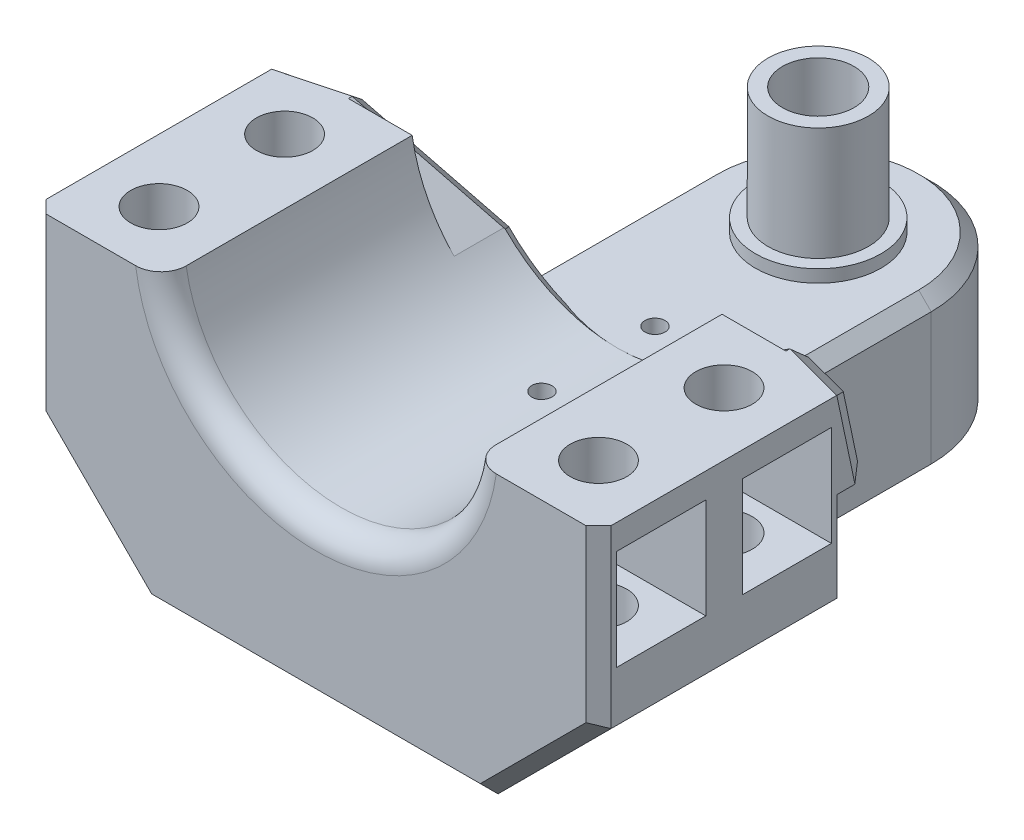
from build123d import *

# Parameters (mm, degrees)
SKETCH1_R               = 2.25
SKETCH1_R_2             = 2.75
BOSS_EXTRUDE1_DEPTH     = 23
CUT_EXTRUDE1_DEPTH      = 10
CUT_EXTRUDE1_DEPTH_BACK = 51.55937104
SKETCH2_R               = 12.5
BOSS_EXTRUDE2_START     = -22.5
BOSS_EXTRUDE2_DEPTH     = 5
CUT_EXTRUDE8_REACH      = 52.496
FILLET1_R               = 2
CHAMFER1_SIZE           = 9
CHAMFER2_SIZE           = 1
SKETCH5_R               = 3.35
CUT_EXTRUDE10_DEPTH     = 4
CUT_EXTRUDE11_START     = -15
SKETCH6_W               = 18
SKETCH6_H               = 3.825324214
CUT_EXTRUDE11_DEPTH     = 36.559371208
CHAMFER3_SIZE           = 1
CHAMFER4_SIZE           = 1
CHAMFER5_SIZE           = 1
CHAMFER6_SIZE           = 1
SKETCH7_R               = 4
SKETCH7_R_2             = 2.85
BOSS_EXTRUDE3_DEPTH     = 10
SKETCH8_R               = 5
SKETCH8_R_2             = 4
EXTRUDE_THIN1_DEPTH     = 1
SKETCH10_R              = 0.3
BOSS_EXTRUDE4_DEPTH     = 4
BOSS_EXTRUDE5_START     = 4
SKETCH11_R              = 2.5
SKETCH11_R_2            = 1.6
BOSS_EXTRUDE5_DEPTH     = 2
SKETCH12_W              = 7.1
SKETCH12_H              = 3
CUT_EXTRUDE12_DEPTH     = 9
CHAMFER7_SIZE           = 5
SKETCH13_R              = 1.6
SKETCH13_R_2            = 0.8
CUT_EXTRUDE13_DEPTH     = 7
BOSS_EXTRUDE6_START     = 2
BOSS_EXTRUDE6_DEPTH     = 2
CUT_EXTRUDE14_REACH     = 52.559
SKETCH13_2_R            = 0.8
CHAMFER8_SIZE           = 1
CHAMFER8_SIZE2          = 1.732050808


with BuildPart() as part:
    # Sketch1 → Boss-Extrude1 (new body)
    with BuildSketch(Plane(origin=(0, 0, 0), x_dir=(1, 0, 0), z_dir=(0, 1, 0))):
        with BuildLine():
            Line((-22.5, -10), (-22.5, 10))
            Line((-22.5, 10), (-9, 10))
            Line((-9, 10), (-9, 30))
            ThreePointArc((-9, 30), (0, 39), (9, 30))
            Line((9, 30), (9, 10))
            Line((9, 10), (22.5, 10))
            Line((22.5, 10), (22.5, -10))
            Line((22.5, -10), (-22.5, -10))
        make_face()
        with Locations(Location((-17.5, 5, 0), (0, 0, 270))):
            Circle(SKETCH1_R, mode=Mode.SUBTRACT)
        with Locations(Location((-17.5, -5, 0), (0, 0, 270))):
            Circle(SKETCH1_R, mode=Mode.SUBTRACT)
        with Locations(Location((17.5, 5, 0), (0, 0, 270))):
            Circle(SKETCH1_R, mode=Mode.SUBTRACT)
        with Locations(Location((17.5, -5, 0), (0, 0, 270))):
            Circle(SKETCH1_R, mode=Mode.SUBTRACT)
        with Locations(Location((0, 30, 0), (0, 0, 270))):
            Circle(SKETCH1_R_2, mode=Mode.SUBTRACT)
    extrude(amount=BOSS_EXTRUDE1_DEPTH)

    # Sketch2 → Cut-Extrude1 (cut, two sides: drawn at the far end of the back side and taken through both)
    with BuildSketch(Plane.XY.offset(-CUT_EXTRUDE1_DEPTH_BACK)):
        with Locations((0, 25)):
            Circle(SKETCH2_R)
    extrude(amount=CUT_EXTRUDE1_DEPTH + CUT_EXTRUDE1_DEPTH_BACK, mode=Mode.SUBTRACT)

    # Sketch3 → Boss-Extrude2 (add)
    with BuildSketch(Plane(origin=(0, 0, -32.5), x_dir=(-1, 0, 0), z_dir=(0, 0, -1)).offset(BOSS_EXTRUDE2_START)):
        Polygon((9, 16.325324214), (17.41948134, 23), (22.5, 23), (22.5, 16.146397564), (9, 5.444060985), align=None)
    boss_extrude2 = extrude(amount=BOSS_EXTRUDE2_DEPTH)

    # Mirror1: Boss-Extrude2 across plane
    add(boss_extrude2.mirror(Plane(origin=(0, 0, 0), x_dir=(0, 0, 1), z_dir=(1, 0, 0))))

    # Sketch4 → Cut-Extrude8 (cut, up to next)
    with BuildSketch(Plane(origin=(4.474031923, 5.643574234, 0), x_dir=(0.7836265295847679, -0.6212322127280048, 0), z_dir=(0.6212322127280048, 0.7836265295847679, 0)), mode=Mode.PRIVATE) as cut_extrude8_sk1:
        Polygon((-17.194456051, 15), (-31.919937808, 10), (-31.919937808, 15.796390808), (-17.194456051, 15.796390808), align=None)
    cut_extrude8_tool1 = extrude(cut_extrude8_sk1.sketch, amount=-CUT_EXTRUDE8_REACH, mode=Mode.PRIVATE) & part.part
    cut_extrude8 = cut_extrude8_tool1.solids().sort_by_distance((-16.228214, 22.055604, -13.832193))[0]
    add(cut_extrude8, mode=Mode.SUBTRACT)

    # Mirror2: Cut-Extrude8 across plane
    add(cut_extrude8.mirror(Plane(origin=(0, 0, 0), x_dir=(0, 0, 1), z_dir=(1, 0, 0))), mode=Mode.SUBTRACT)

    # Fillet1
    fillet1_edges = [part.edges().sort_by_distance(p)[0] for p in [
        (0, 12.5, 10),
    ]]
    fillet(fillet1_edges, radius=FILLET1_R)

    # Chamfer1
    # the kernel refuses this chamfer: 9 mm, written as the material it takes off along each edge
    with BuildSketch(Plane(origin=(22.5, 0, -33.145146892), x_dir=(-0.9996219169112966, -0.027495876610586365, 0), z_dir=(0, 0, 1))) as chamfer1_piece_1:
        Polygon((CHAMFER1_SIZE * 0.999621916911, -CHAMFER1_SIZE * 0.0274958766106), (-CHAMFER1_SIZE * 0.0274958766106, -CHAMFER1_SIZE * 0.999621916911), (0, 0), align=None)
    extrude(amount=66.290293783, mode=Mode.SUBTRACT)
    with BuildSketch(Plane(origin=(-22.5, 0, 33.145146892), x_dir=(-0.02749587661058639, 0.9996219169112966, 0), z_dir=(0, 0, -1))) as chamfer1_piece_2:
        Polygon((CHAMFER1_SIZE * 0.999621916911, CHAMFER1_SIZE * 0.0274958766106), (-CHAMFER1_SIZE * 0.0274958766106, CHAMFER1_SIZE * 0.999621916911), (0, 0), align=None)
    extrude(amount=66.290293783, mode=Mode.SUBTRACT)

    # Chamfer2
    chamfer2_edges = [part.edges().sort_by_distance(p)[0] for p in [
        (-11.25, 0, -10),
        (11.25, 0, -10),
        (18, 4.5, -10),
        (0, 0, 10),
        (-18, 4.5, 10),
        (18, 4.5, 10),
        (-18, 4.5, -10),
        (22.5, 16, 10),
        (-22.5, 16, 10),
        (-22.5, 12.573198782, -10),
        (22.5, 12.573198782, -10),
        (-9, 0, -20),
        (0, 0, -39),
        (9, 0, -20),
    ]]
    chamfer(chamfer2_edges, length=CHAMFER2_SIZE)

    # Sketch5 → Cut-Extrude10 (cut)
    with BuildSketch(Plane(origin=(0, 0, 0), x_dir=(1, 0, 0), z_dir=(0, 1, 0))):
        with Locations(Location((0, 30, 0), (0, 0, 270))):
            Circle(SKETCH5_R)
    extrude(amount=CUT_EXTRUDE10_DEPTH, mode=Mode.SUBTRACT)

    # Sketch6 → Cut-Extrude11 (cut, through all)
    with BuildSketch(Plane.XY.offset(CUT_EXTRUDE11_START)):
        with Locations((0, 14.412662107)):
            Rectangle(SKETCH6_W, SKETCH6_H)
    extrude(amount=-CUT_EXTRUDE11_DEPTH, mode=Mode.SUBTRACT)

    # Chamfer3
    chamfer3_edges = [part.edges().sort_by_distance(p)[0] for p in [
        (0, 12.5, -39),
        (9, 12.5, -22.5),
        (-9, 12.5, -22.5),
    ]]
    chamfer(chamfer3_edges, length=CHAMFER3_SIZE)

    # Chamfer4
    # the kernel refuses this chamfer: 1 mm, written as the material it takes off along each edge
    with BuildSketch(Plane(origin=(0, 25, -15), x_dir=(0, -1, 0), z_dir=(1, 0, 0))) as chamfer4_piece_1_section:
        Polygon((12.5 + CHAMFER4_SIZE, 0), (12.5, -CHAMFER4_SIZE), (12.5, 0), align=None)
    chamfer4_piece_1 = revolve(axis=Axis((0, 25, -15), (0, 0, -1)), revolution_arc=57.843446633, mode=Mode.PRIVATE)
    chamfer4_piece_1 = split(chamfer4_piece_1, bisect_by=Plane(origin=(-3.818564671, 12.5, -14.588370219), z_dir=(0, 1, 0)), keep=Keep.TOP, mode=Mode.PRIVATE)
    add(chamfer4_piece_1, mode=Mode.SUBTRACT)
    with BuildSketch(Plane(origin=(0, 25, -15), x_dir=(0.8465969958559083, -0.5322344658209869, 0), z_dir=(0.5322344658209869, 0.8465969958559083, 0))) as chamfer4_piece_2_section:
        Polygon((12.5, -CHAMFER4_SIZE), (12.5 + CHAMFER4_SIZE, 0), (12.5, 0), align=None)
    chamfer4_piece_2 = revolve(axis=Axis((0, 25, -15), (0, 0, -1)), revolution_arc=57.843446633, mode=Mode.PRIVATE)
    chamfer4_piece_2 = split(chamfer4_piece_2, bisect_by=Plane(origin=(7.537884287, 12.5, -14.673877281), z_dir=(0, 1, 0)), keep=Keep.TOP, mode=Mode.PRIVATE)
    add(chamfer4_piece_2, mode=Mode.SUBTRACT)

    # Chamfer5
    chamfer5_edges = [part.edges().sort_by_distance(p)[0] for p in [
        (-11.648575872, 7.543761018, -15),
        (-18.398575872, 12.894929307, -13.222841989),
        (-13.931019885, 20.234467509, -12.863375935),
        (18.398575872, 12.894929307, -13.222841989),
        (11.648575872, 7.543761018, -15),
        (13.931019885, 20.234467509, -12.863375935),
    ]]
    chamfer(chamfer5_edges, length=CHAMFER5_SIZE)

    # Chamfer6
    chamfer6_edges = [part.edges().sort_by_distance(p)[0] for p in [
        (20.764592688, 23, -10.461754404),
        (-22.5, 20.211257833, -10.588251201),
        (22.5, 20.211257833, -10.588251201),
        (-20.764592688, 23, -10.461754404),
    ]]
    chamfer(chamfer6_edges, length=CHAMFER6_SIZE)

    # Sketch7 → Boss-Extrude3 (add)
    with BuildSketch(Plane(origin=(0, 12.5, 0), x_dir=(1, 0, 0), z_dir=(0, 1, 0))):
        with Locations((0, 30)):
            Circle(SKETCH7_R)
        with Locations(Location((0, 30, 0), (0, 0, 180))):
            Circle(SKETCH7_R_2, mode=Mode.SUBTRACT)
    extrude(amount=BOSS_EXTRUDE3_DEPTH)

    # Sketch8 → Extrude-Thin1 (add)
    with BuildSketch(Plane(origin=(0, 12.5, 0), x_dir=(1, 0, 0), z_dir=(0, 1, 0))):
        with Locations((0, 30)):
            Circle(SKETCH8_R)
        with Locations((0, 30)):
            Circle(SKETCH8_R_2, mode=Mode.SUBTRACT)
    extrude(amount=EXTRUDE_THIN1_DEPTH)

    # Sketch10 → Boss-Extrude4 (add)
    with BuildSketch(Plane(origin=(0, 0, 0), x_dir=(1, 0, 0), z_dir=(0, 1, 0))):
        with Locations((0.219852061, 26.8)):
            Circle(SKETCH10_R)
        with Locations((-0.582862634, 26.8458589)):
            Circle(SKETCH10_R)
        with Locations((-1.348953927, 27.089904086)):
            Circle(SKETCH10_R)
        with Locations((-2.030285484, 27.5168013)):
            Circle(SKETCH10_R)
        with Locations((-2.584046736, 28.099727021)):
            Circle(SKETCH10_R)
        with Locations((-2.975442829, 28.802053882)):
            Circle(SKETCH10_R)
        with Locations((-3.179880906, 29.579652104)):
            Circle(SKETCH10_R)
        with Locations((-3.184515371, 30.38366233)):
            Circle(SKETCH10_R)
        with Locations((-2.989055023, 31.16356564)):
            Circle(SKETCH10_R)
        with Locations((-2.605781355, 31.870357842)):
            Circle(SKETCH10_R)
        with Locations((-2.058776861, 32.459628583)):
            Circle(SKETCH10_R)
        with Locations((-1.382411846, 32.894351813)):
            Circle(SKETCH10_R)
        with Locations((-0.61918481, 33.147212274)):
            Circle(SKETCH10_R)
        with Locations((0.182947885, 33.202321814)):
            Circle(SKETCH10_R)
        with Locations((0.973585292, 33.056217697)):
            Circle(SKETCH10_R)
        with Locations((1.703048753, 32.718080181)):
            Circle(SKETCH10_R)
        with Locations((2.325503399, 32.209155692)):
            Circle(SKETCH10_R)
        with Locations((2.801838113, 31.561421826)):
            Circle(SKETCH10_R)
        with Locations((3.102123034, 30.815578084)):
            Circle(SKETCH10_R)
        with Locations((3.207490156, 30.018488571)):
            Circle(SKETCH10_R)
        with Locations((3.111318875, 29.220237354)):
            Circle(SKETCH10_R)
        with Locations((2.819651987, 28.470981491)):
            Circle(SKETCH10_R)
        with Locations((2.350815994, 27.817799485)):
            Circle(SKETCH10_R)
        with Locations((1.734269587, 27.301733162)):
            Circle(SKETCH10_R)
        with Locations((1.008752644, 26.955208869)):
            Circle(SKETCH10_R)
    extrude(amount=BOSS_EXTRUDE4_DEPTH)

    # Sketch12 → Cut-Extrude12 (cut)
    with BuildSketch(Plane.ZY.offset(22.5)):
        with Locations((5, 14.5)):
            Rectangle(SKETCH12_W, SKETCH12_H)
        with Locations((-5, 14.5)):
            Rectangle(SKETCH12_W, SKETCH12_H)
    cut_extrude12 = extrude(amount=-CUT_EXTRUDE12_DEPTH, mode=Mode.SUBTRACT)

    # Mirror3: Cut-Extrude12 across plane
    add(cut_extrude12.mirror(Plane(origin=(0, 0, 0), x_dir=(0, 0, 1), z_dir=(1, 0, 0))), mode=Mode.SUBTRACT)

    # Chamfer7
    # the kernel refuses this chamfer: 5 mm, written as the material it takes off along each edge
    with BuildSketch(Plane(origin=(-22.5, 16, 8.55), x_dir=(-0.027495876610586317, 0.9996219169112968, 0), z_dir=(0, 0, -1)), Plane(origin=(22.5, 16, -8.55), x_dir=(0.027495876610586317, 0.9996219169112968, 0), z_dir=(0, 0, 1))) as chamfer7_piece_1:
        Polygon((CHAMFER7_SIZE * 0.999621916911, CHAMFER7_SIZE * 0.0274958766106), (-CHAMFER7_SIZE * 0.0274958766106, CHAMFER7_SIZE * 0.999621916911), (0, 0), align=None)
    extrude(amount=7.1, mode=Mode.SUBTRACT)
    with BuildSketch(Plane(origin=(-22.5, 16, 21.40841494), x_dir=(-0.027495876610586317, 0.9996219169112968, 0), z_dir=(0, 0, -1))) as chamfer7_piece_2_section:
        Polygon((CHAMFER7_SIZE * 0.999621916911, CHAMFER7_SIZE * 0.0274958766106), (-CHAMFER7_SIZE * 0.0274958766106, CHAMFER7_SIZE * 0.999621916911), (0, 0), align=None)
    chamfer7_piece_2 = extrude(amount=32.81682988, mode=Mode.PRIVATE)
    chamfer7_piece_2 = split(chamfer7_piece_2, bisect_by=Plane(origin=(-21.019540494, 17.762635971, -8.55), z_dir=(0, 0, 1)), keep=Keep.TOP, mode=Mode.PRIVATE)
    chamfer7_piece_2 = split(chamfer7_piece_2, bisect_by=Plane(origin=(-21.019540494, 17.762635971, -1.45), z_dir=(0, 0, -1)), keep=Keep.TOP, mode=Mode.PRIVATE)
    add(chamfer7_piece_2, mode=Mode.SUBTRACT)
    with BuildSketch(Plane(origin=(-22.5, 16, -8.55), x_dir=(-0.027495876610586317, 0.9996219169112968, 0), z_dir=(0, 0, 1)), Plane(origin=(22.5, 16, 8.55), x_dir=(0.027495876610586317, 0.9996219169112968, 0), z_dir=(0, 0, -1))) as chamfer7_piece_3:
        Polygon((CHAMFER7_SIZE * 0.999621916911, -CHAMFER7_SIZE * 0.0274958766106), (-CHAMFER7_SIZE * 0.0274958766106, -CHAMFER7_SIZE * 0.999621916911), (0, 0), align=None)
    extrude(amount=7.1, mode=Mode.SUBTRACT)
    with BuildSketch(Plane(origin=(-22.5, 16, -21.40841494), x_dir=(-0.027495876610586317, 0.9996219169112968, 0), z_dir=(0, 0, 1))) as chamfer7_piece_4_section:
        Polygon((CHAMFER7_SIZE * 0.999621916911, -CHAMFER7_SIZE * 0.0274958766106), (-CHAMFER7_SIZE * 0.0274958766106, -CHAMFER7_SIZE * 0.999621916911), (0, 0), align=None)
    chamfer7_piece_4 = extrude(amount=32.81682988, mode=Mode.PRIVATE)
    chamfer7_piece_4 = split(chamfer7_piece_4, bisect_by=Plane(origin=(-21.019540494, 17.762635971, 1.45), z_dir=(0, 0, 1)), keep=Keep.TOP, mode=Mode.PRIVATE)
    chamfer7_piece_4 = split(chamfer7_piece_4, bisect_by=Plane(origin=(-21.019540494, 17.762635971, 8.55), z_dir=(0, 0, -1)), keep=Keep.TOP, mode=Mode.PRIVATE)
    add(chamfer7_piece_4, mode=Mode.SUBTRACT)
    with BuildSketch(Plane(origin=(22.5, 16, 21.40841494), x_dir=(0.027495876610586317, 0.9996219169112968, 0), z_dir=(0, 0, -1))) as chamfer7_piece_5_section:
        Polygon((CHAMFER7_SIZE * 0.999621916911, -CHAMFER7_SIZE * 0.0274958766106), (-CHAMFER7_SIZE * 0.0274958766106, -CHAMFER7_SIZE * 0.999621916911), (0, 0), align=None)
    chamfer7_piece_5 = extrude(amount=32.81682988, mode=Mode.PRIVATE)
    chamfer7_piece_5 = split(chamfer7_piece_5, bisect_by=Plane(origin=(21.019540494, 17.762635972, -1.45), z_dir=(0, 0, -1)), keep=Keep.TOP, mode=Mode.PRIVATE)
    chamfer7_piece_5 = split(chamfer7_piece_5, bisect_by=Plane(origin=(21.019540494, 17.762635972, -8.55), z_dir=(0, 0, 1)), keep=Keep.TOP, mode=Mode.PRIVATE)
    add(chamfer7_piece_5, mode=Mode.SUBTRACT)
    with BuildSketch(Plane(origin=(22.5, 16, -21.40841494), x_dir=(0.027495876610586317, 0.9996219169112968, 0), z_dir=(0, 0, 1))) as chamfer7_piece_6_section:
        Polygon((CHAMFER7_SIZE * 0.999621916911, CHAMFER7_SIZE * 0.0274958766106), (-CHAMFER7_SIZE * 0.0274958766106, CHAMFER7_SIZE * 0.999621916911), (0, 0), align=None)
    chamfer7_piece_6 = extrude(amount=32.81682988, mode=Mode.PRIVATE)
    chamfer7_piece_6 = split(chamfer7_piece_6, bisect_by=Plane(origin=(21.019540494, 17.762635972, 8.55), z_dir=(0, 0, -1)), keep=Keep.TOP, mode=Mode.PRIVATE)
    chamfer7_piece_6 = split(chamfer7_piece_6, bisect_by=Plane(origin=(21.019540494, 17.762635972, 1.45), z_dir=(0, 0, 1)), keep=Keep.TOP, mode=Mode.PRIVATE)
    add(chamfer7_piece_6, mode=Mode.SUBTRACT)


with BuildPart() as body_2:
    # Sketch11 → Boss-Extrude5 (new body)
    with BuildSketch(Plane(origin=(0, 0, 0), x_dir=(1, 0, 0), z_dir=(0, 1, 0)).offset(BOSS_EXTRUDE5_START)):
        with Locations(Location((0, 30, 0), (0, 0, 270))):
            Circle(SKETCH11_R)
        with Locations(Location((0, 30, 0), (0, 0, 270))):
            Circle(SKETCH11_R_2, mode=Mode.SUBTRACT)
    extrude(amount=BOSS_EXTRUDE5_DEPTH)


with BuildPart() as cut_extrude13_tool:
    # Sketch13 → Cut-Extrude13 (new body)
    with BuildSketch(Plane(origin=(0, 0, 0), x_dir=(1, 0, 0), z_dir=(0, 1, 0))):
        with BuildLine():
            Line((-4, 7.2), (-7.7, 30))
            ThreePointArc((-7.7, 30), (0, 37.7), (7.7, 30))
            Line((7.7, 30), (4, 7.2))
            ThreePointArc((4, 7.2), (0, 3.2), (-4, 7.2))
        make_face()
        with Locations((0, 30)):
            Circle(SKETCH13_R, mode=Mode.SUBTRACT)
        with Locations(Location((0, 17, 0), (0, 0, 270))):
            Circle(SKETCH13_R_2, mode=Mode.SUBTRACT)
        with Locations(Location((0, 8, 0), (0, 0, 270))):
            Circle(SKETCH13_R_2, mode=Mode.SUBTRACT)
    extrude(amount=CUT_EXTRUDE13_DEPTH)


with BuildPart() as part_1:
    add(part.part)

    # Cut-Extrude13: cut by cut_extrude13_tool
    add(cut_extrude13_tool.part, mode=Mode.SUBTRACT)

    # Sketch14 → Boss-Extrude6 (add)
    with BuildSketch(Plane(origin=(0, 7, 0), x_dir=(-1, 0, 0), z_dir=(0, -1, 0)).offset(BOSS_EXTRUDE6_START)):
        with BuildLine():
            Line((-6.401754386, 22), (6.401754386, 22))
            Line((6.401754386, 22), (4, 7.2))
            ThreePointArc((4, 7.2), (0, 3.2), (-4, 7.2))
            Line((-4, 7.2), (-6.401754386, 22))
        make_face()
    extrude(amount=-BOSS_EXTRUDE6_DEPTH)

    # Sketch13<2> → Cut-Extrude14 (cut, up to next)
    with BuildSketch(Plane(origin=(0, 0, 0), x_dir=(1, 0, 0), z_dir=(0, 1, 0)), mode=Mode.PRIVATE) as cut_extrude14_sk1:
        with Locations(Location((0, 17, 0), (0, 0, 90))):
            Circle(SKETCH13_2_R)
    cut_extrude14_tool1 = extrude(cut_extrude14_sk1.sketch, amount=CUT_EXTRUDE14_REACH, mode=Mode.PRIVATE) & part_1.part
    # Sketch13<2> → Cut-Extrude14 (cut, up to next)
    with BuildSketch(Plane(origin=(0, 0, 0), x_dir=(1, 0, 0), z_dir=(0, 1, 0)), mode=Mode.PRIVATE) as cut_extrude14_sk2:
        with Locations(Location((0, 8, 0), (0, 0, 90))):
            Circle(SKETCH13_2_R)
    cut_extrude14_tool2 = extrude(cut_extrude14_sk2.sketch, amount=CUT_EXTRUDE14_REACH, mode=Mode.PRIVATE) & part_1.part
    add(cut_extrude14_tool1.solids().sort_by_distance((0, 0, -17))[0], mode=Mode.SUBTRACT)
    add(cut_extrude14_tool2.solids().sort_by_distance((0, 0, -8))[0], mode=Mode.SUBTRACT)

    # Chamfer8
    chamfer8_edges = [part_1.edges().sort_by_distance(p)[0] for p in [
        (0, 7, -22),
    ]]
    chamfer8_side = [part_1.faces().sort_by_distance(p)[0] for p in [
        (0, 7, -22.21992044),
    ]]
    chamfer(chamfer8_edges, length=CHAMFER8_SIZE, length2=CHAMFER8_SIZE2, reference=chamfer8_side[0])


with BuildPart() as body_2_1:
    add(body_2.part)

    # Cut-Extrude13: cut by cut_extrude13_tool
    add(cut_extrude13_tool.part, mode=Mode.SUBTRACT)


solid = part_1.part
